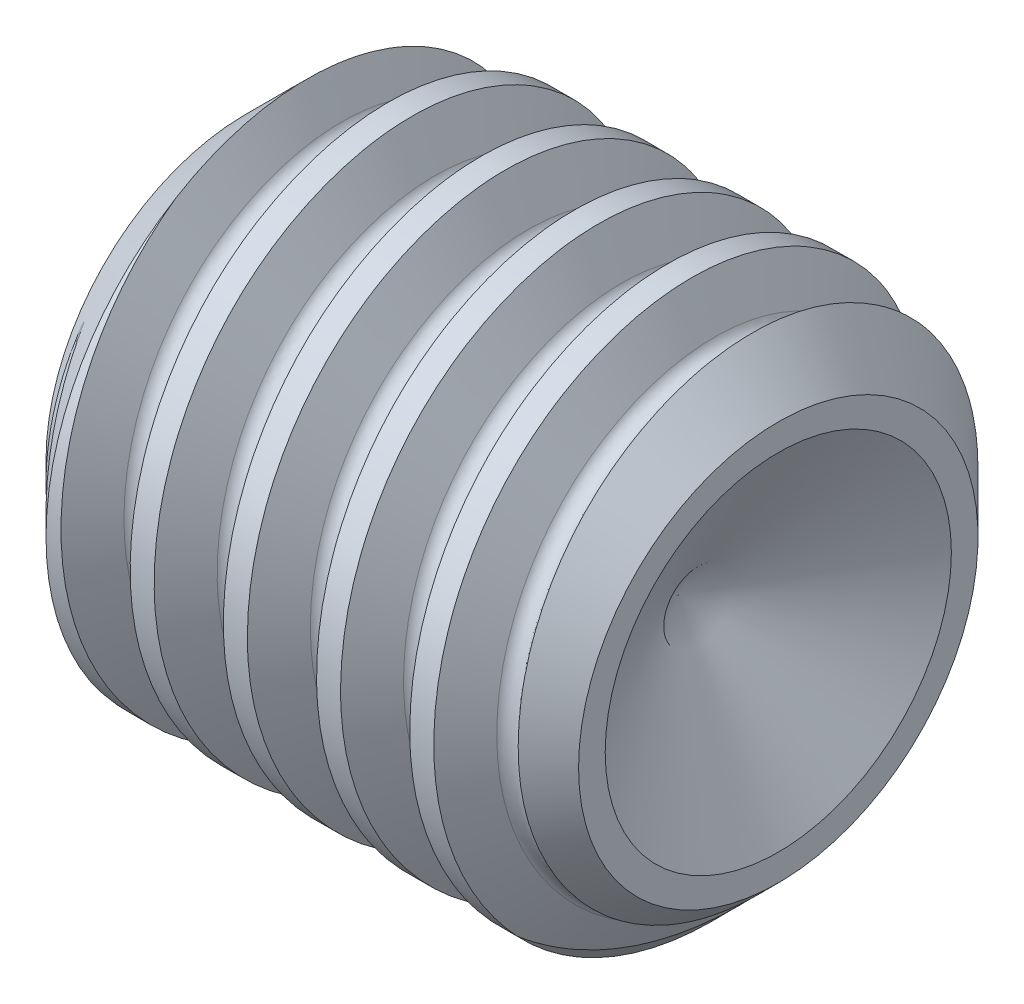
from build123d import *

# Parameters (mm, degrees)
CUT_EXTRUDE_1_DEPTH = 1.6
SWEEP_1_PITCH       = 0.7


with BuildPart() as part:
    # Эскиз1 → Повернуть1 (revolve)
    with BuildSketch(Plane.XY, mode=Mode.PRIVATE) as revolve_1_sk:
        Polygon((2, 0), (3.24944465, 0), (4, 1.3), (4, 1.5), (3.5, 2), (0.5, 2), (0, 1.5), (0, 1.2), (0.2, 1), (1.566987298, 1), (2, 0.25), align=None)
    revolve(revolve_1_sk.sketch.rotate(Axis((2, 0, 0), (1, 0, 0)), 90), axis=Axis((2, 0, 0), (1, 0, 0)))

    # Эскиз2 → Вырез-Вытянуть1 (cut)
    with BuildSketch(Plane.ZY):
        Polygon((-0.577350269, 1), (-1.154700538, 0), (-0.577350269, -1), (0.577350269, -1), (1.154700538, 0), (0.577350269, 1), align=None)
    extrude(amount=-CUT_EXTRUDE_1_DEPTH, mode=Mode.SUBTRACT)

    # Вырез-По траектории1: arcs per turn and ends read off the stored shape
    # Вырез-По траектории1: the profile of Эскиз4 profile screwed along a right-hand helix through 6 turns, 6 arcs to a turn; built about Z, then put on its axis
    sweep_1_z = Axis((0, 0, 0), (0, 0, 1))
    sweep_1_corners = [(2.0003, 0, 0.084980826), (2.0003, 0, -0.434980826), (1.7, 0, -0.26160254), (1.65, 0, -0.175), (1.7, 0, -0.08839746)]
    with BuildLine(mode=Mode.PRIVATE) as sweep_1_profile:
        Line(sweep_1_corners[0], sweep_1_corners[1])
        Line(sweep_1_corners[1], sweep_1_corners[2])
        Line(sweep_1_corners[4], sweep_1_corners[0])
        ThreePointArc((1.7, 0, -0.26160254), (1.66339746, 0, -0.225), (1.65, 0, -0.175))
        ThreePointArc((1.65, 0, -0.175), (1.66339746, 0, -0.125), (1.7, 0, -0.08839746))
    sweep_1_cap = Face(sweep_1_profile.wire())
    sweep_1_arcs = [((1.7, 0, -0.26160254), (1.65, 0, -0.232735027), (1.65, 0, -0.175), (1, 0.8660254037844393, 1)), ((1.65, 0, -0.175), (1.65, 0, -0.117264973), (1.7, 0, -0.08839746), (1, 0.8660254037844393, 1))]  # start, shoulder, end, weights
    sweep_1_turn_angles = [0, 30, 60, 90, 120, 150, 180, 210, 240, 270, 300, 330, 360]
    sweep_1_turn_weights = [1, 0.8660254037844387, 1, 0.8660254037844387, 1, 0.8660254037844387, 1, 0.8660254037844387, 1, 0.8660254037844387, 1, 0.8660254037844387, 1]
    sweep_1_turn_rails = [Edge.make_bspline([Vector(p[0], p[1], 0).rotate(sweep_1_z, sweep_1_turn_angles[k]) / sweep_1_turn_weights[k] + Vector(0, 0, p[2] + SWEEP_1_PITCH * sweep_1_turn_angles[k] / 360) for k in range(13)], [0, 0, 0, 1, 1, 2, 2, 3, 3, 4, 4, 5, 5, 6, 6, 6], 2, sweep_1_turn_weights) for p in sweep_1_corners]
    sweep_1_turn_sides = [*[Face.make_surface_from_curves(sweep_1_turn_rails[p[0]], sweep_1_turn_rails[p[1]]) for p in [(0, 1), (1, 2), (4, 0)]], *[Face.make_bezier_surface([[Vector(p[j][0], p[j][1], 0).rotate(sweep_1_z, sweep_1_turn_angles[2 * i + k]) / sweep_1_turn_weights[2 * i + k] + Vector(0, 0, p[j][2] + SWEEP_1_PITCH * sweep_1_turn_angles[2 * i + k] / 360) for k in range(3)] for j in range(3)], [[p[3][j] * sweep_1_turn_weights[2 * i + k] for k in range(3)] for j in range(3)]) for p in sweep_1_arcs for i in range(6)]]
    sweep_1 = Plane(origin=(0, 0, 0), x_dir=(0, 0, -1), z_dir=(1, 0, 0)) * Solid(Shell([*[p.moved(Location((0, 0, SWEEP_1_PITCH * i))) for i in range(6) for p in sweep_1_turn_sides], sweep_1_cap, sweep_1_cap.rotate(sweep_1_z, 2160).moved(Location((0, 0, SWEEP_1_PITCH * 2160 / 360)))]))
    add(sweep_1, mode=Mode.SUBTRACT)


solid = part.part
